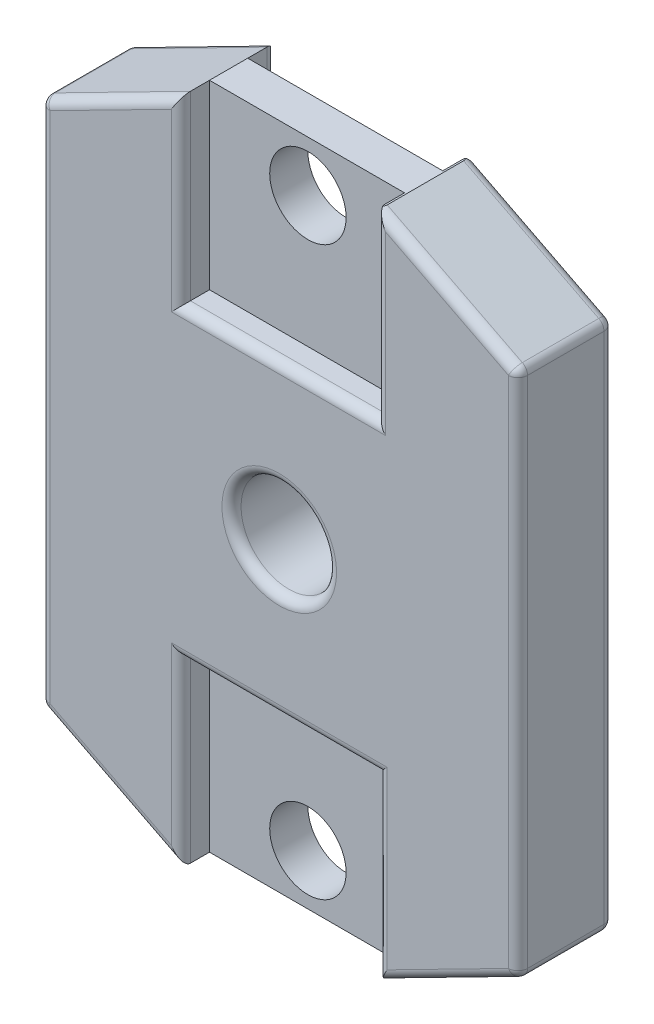
from build123d import *

# Parameters (mm, degrees)
SKETCH_1_W              = 5
SKETCH_1_H              = 7.000000000000001
EXTRUDE_1_DEPTH         = 1
EXTRUDE_2_DEPTH         = 0.25
SKETCH_4_R              = 0.7000000000000005
EXTRUDE_3_DEPTH         = 0.35
SKETCH_5_R              = 0.4999999999999999
CUT_EXTRUDE_1_DEPTH     = 9.707611612836208
CUT_EXTRUDE_2_DEPTH     = 9.660254037844387
SKETCH_8_W              = 2.0606123086601853
SKETCH_8_H              = 1.9
CUT_EXTRUDE_3_DEPTH     = 0.3
CUT_EXTRUDE_4_DEPTH     = 0.3
HOLE_WIZARD_0_8_0_8_1_D = 0.8
FILLET_1_R              = 0.1
FILLET_3_R              = 0.05


with BuildPart() as part:
    # 草图1 → 凸台-拉伸1 (new body)
    with BuildSketch(Plane.XY):
        with Locations((2.5, 3.5000000000000004)):
            Rectangle(SKETCH_1_W, SKETCH_1_H)
    extrude(amount=EXTRUDE_1_DEPTH)

    # 草图2 → 凸台-拉伸2 (add)
    with BuildSketch(Plane.XY):
        with BuildLine():
            ThreePointArc((3.078576199554736, 4.31000667937663), (2.500000000000009, 4.49542013206784), (1.9214238004452784, 4.310006679376641))
            Line((1.9214238004452648, 4.310006679376629), (2.093133264396633, 4.069613429844714))
            ThreePointArc((2.0931332643966383, 4.069613429844718), (2.500000000000017, 4.2), (2.9068667356033893, 4.069613429844699))
            Line((2.906866735603367, 4.069613429844714), (3.0785761995547354, 4.310006679376629))
        make_face()
        with BuildLine():
            Line((2.093133264396633, 4.069613429844714), (1.9214238004452648, 4.310006679376629))
            ThreePointArc((1.9214238004452784, 4.310006679376641), (1.5045798679321596, 3.5), (1.9214238004452784, 2.6899933206233593))
            Line((1.9214238004452637, 2.68999332062337), (2.0931332643966316, 2.9303865701552843))
            ThreePointArc((2.0931332643966374, 2.930386570155282), (1.7999999999999998, 3.5000000000000004), (2.0931332643966383, 4.069613429844718))
        make_face()
        with BuildLine():
            ThreePointArc((3.4954201320678404, 3.5), (3.3850953723464046, 3.955485917649422), (3.078576199554736, 4.31000667937663))
            Line((3.0785761995547354, 4.310006679376629), (2.906866735603367, 4.069613429844714))
            ThreePointArc((2.9068667356033893, 4.069613429844699), (3.122417349903733, 3.8203071066005463), (3.2, 3.5))
            ThreePointArc((3.2, 3.5), (3.122417349903733, 3.1796928933994537), (2.9068667356033897, 2.930386570155301))
            Line((2.9068667356033684, 2.9303865701552843), (3.0785761995547367, 2.689993320623369))
            ThreePointArc((3.0785761995547354, 2.6899933206233695), (3.3850953723464046, 3.0445140823505774), (3.4954201320678404, 3.4999999999999996))
        make_face()
        with BuildLine():
            Line((2.0931332643966316, 2.9303865701552843), (1.9214238004452637, 2.68999332062337))
            ThreePointArc((1.9214238004452784, 2.6899933206233593), (2.5000000000000084, 2.5045798679321596), (3.0785761995547354, 2.6899933206233695))
            Line((3.0785761995547367, 2.689993320623369), (2.9068667356033684, 2.9303865701552843))
            ThreePointArc((2.9068667356033897, 2.930386570155301), (2.500000000000017, 2.8), (2.0931332643966374, 2.930386570155282))
        make_face()
    extrude(amount=-EXTRUDE_2_DEPTH)

    # 草图4 → 凸台-拉伸3 (add)
    with BuildSketch(Plane(origin=(0, 0, 0), x_dir=(-1, 0, 0), z_dir=(0, 0, -1))):
        with Locations(Location((-2.5, 3.5, 0), (0, 0, 180))):
            Circle(SKETCH_4_R)
    extrude(amount=EXTRUDE_3_DEPTH)

    # 草图5 → 切除-拉伸1 (cut, through all)
    with BuildSketch(Plane(origin=(0, 0, -0.35), x_dir=(-1, 0, 0), z_dir=(0, 0, -1))):
        with Locations((-2.5, 3.5)):
            Circle(SKETCH_5_R)
    extrude(amount=-CUT_EXTRUDE_1_DEPTH, mode=Mode.SUBTRACT)

    # 草图7 → 切除-拉伸2 (cut, through all)
    with BuildSketch(Plane.XY):
        Polygon((3.5303061543300926, 7), (4.999999999999998, 6.25), (5, 7), align=None)
        Polygon((0, 6.25), (1.4696938456699076, 7), (0, 7), align=None)
        Polygon((0, 0.75), (0, 0), (1.4696938456699078, 0), align=None)
        Polygon((5, 0.7500000000000002), (3.5303061543300935, 0), (5, 0), align=None)
    extrude(amount=CUT_EXTRUDE_2_DEPTH, mode=Mode.SUBTRACT)

    # 草图8 → 切除-拉伸3 (cut)
    with BuildSketch(Plane.XY):
        Polygon((1.4696938456699076, 6.999999999999999), (1.469693845669908, 5.1), (3.5121371275448117, 5.1), (3.5121371275448108, 6.999999999999998), align=None)
        with Locations((2.5000000000000004, 0.95)):
            Rectangle(SKETCH_8_W, SKETCH_8_H)
    extrude(amount=CUT_EXTRUDE_3_DEPTH, mode=Mode.SUBTRACT)

    # 草图9 → 切除-拉伸4 (cut)
    with BuildSketch(Plane.XY.offset(1)):
        Polygon((1.4696938456699076, 6.999999999999999), (1.4696938456699078, 5.1), (3.5121371275448108, 5.1), (3.5121371275448108, 6.999999999999998), align=None)
        Polygon((1.4696938456699078, -1.1e-16), (3.5303061543300935, 0), (3.5303061543300935, 1.9), (1.4696938456699078, 1.9), align=None)
    extrude(amount=-CUT_EXTRUDE_4_DEPTH, mode=Mode.SUBTRACT)

    # Ø0.8 (0.8) 直径孔1 (through all)
    with Locations(Plane(origin=(0, 0, 0.3), x_dir=(-1, 0, 0), z_dir=(0, 0, -1))):
        with Locations((-2.5, 6.47), (-2.5, 0.53)):
            Hole(HOLE_WIZARD_0_8_0_8_1_D / 2)

    # 圆角1
    # the kernel refuses this fillet: 0.1 mm, written as the material it adds along each edge
    with BuildSketch(Plane(origin=(2.5, 3.5000000000000004, 0), x_dir=(-0.581238193719089, -0.8137334712067403, 0), z_dir=(-0.8137334712067403, 0.581238193719089, 0))) as fillet_1_piece_1:
        with BuildLine():
            CenterArc((0.9954201320678407 + FILLET_1_R, -FILLET_1_R), FILLET_1_R, 90, 90)
            Line((0.9954201320678406, -FILLET_1_R), (0.9954201320678407, 0))
            Line((0.9954201320678407, 0), (0.9954201320678407 + FILLET_1_R, 0))
        make_face()
    revolve(axis=Axis((2.5, 3.5000000000000004, 0), (0, 0, 1)))
    # the kernel refuses this fillet: 0.1 mm, written as the material it takes off along each edge
    with BuildSketch(Plane(origin=(0.1, 6.18876275643042, 0.9), x_dir=(-1, 0, 0), z_dir=(0, 0, 1))) as fillet_1_2_piece_1_section:
        Polygon((0, 0), (FILLET_1_R, 0), (FILLET_1_R, -FILLET_1_R * 0.612372435696), (FILLET_1_R * 0.454545454545, -FILLET_1_R * 0.89072354283), align=None)
    fillet_1_2_piece_1 = extrude(amount=FILLET_1_R, mode=Mode.PRIVATE)
    fillet_1_2_piece_1 = fillet_1_2_piece_1 - Plane(origin=(0.1, 6.18876275643042, 0.9), x_dir=(0.8528028654224417, -0.5222329678670936, 0), z_dir=(0, 0, 1)) * Sphere(FILLET_1_R, mode=Mode.PRIVATE)
    add(fillet_1_2_piece_1, mode=Mode.SUBTRACT)
    with BuildSketch(Plane(origin=(4.899999999999999, 6.18876275643042, 0.9), x_dir=(1, 0, 0), z_dir=(0, 0, 1))) as fillet_1_2_piece_2_section:
        Polygon((0, 0), (FILLET_1_R, 0), (FILLET_1_R, FILLET_1_R * 0.612372435696), (FILLET_1_R * 0.454545454545, FILLET_1_R * 0.89072354283), align=None)
    fillet_1_2_piece_2 = extrude(amount=FILLET_1_R, mode=Mode.PRIVATE)
    fillet_1_2_piece_2 = fillet_1_2_piece_2 - Plane(origin=(4.899999999999999, 6.18876275643042, 0.9), x_dir=(-0.8528028654224419, -0.5222329678670934, 0), z_dir=(0, 0, 1)) * Sphere(FILLET_1_R, mode=Mode.PRIVATE)
    add(fillet_1_2_piece_2, mode=Mode.SUBTRACT)
    with BuildSketch(Plane(origin=(4.900000000000001, 0.8112372435695803, 0.9), x_dir=(1, 0, 0), z_dir=(0, 0, 1))) as fillet_1_2_piece_3_section:
        Polygon((0, 0), (FILLET_1_R, 0), (FILLET_1_R, -FILLET_1_R * 0.612372435696), (FILLET_1_R * 0.454545454545, -FILLET_1_R * 0.89072354283), align=None)
    fillet_1_2_piece_3 = extrude(amount=FILLET_1_R, mode=Mode.PRIVATE)
    fillet_1_2_piece_3 = fillet_1_2_piece_3 - Plane(origin=(4.900000000000001, 0.8112372435695803, 0.9), x_dir=(-0.8528028654224419, 0.5222329678670934, 0), z_dir=(0, 0, 1)) * Sphere(FILLET_1_R, mode=Mode.PRIVATE)
    add(fillet_1_2_piece_3, mode=Mode.SUBTRACT)
    with BuildSketch(Plane(origin=(0.1, 0.8112372435695789, 0.9), x_dir=(-0.45454545454545436, -0.8907235428302468, 0), z_dir=(0, 0, 1))) as fillet_1_2_piece_4_section:
        Polygon((0, 0), (FILLET_1_R, 0), (FILLET_1_R, -FILLET_1_R * 0.612372435696), (FILLET_1_R * 0.454545454545, -FILLET_1_R * 0.89072354283), align=None)
    fillet_1_2_piece_4 = extrude(amount=FILLET_1_R, mode=Mode.PRIVATE)
    fillet_1_2_piece_4 = fillet_1_2_piece_4 - Plane(origin=(0.1, 0.8112372435695789, 0.9), x_dir=(0.8528028654224415, 0.5222329678670936, 0), z_dir=(0, 0, 1)) * Sphere(FILLET_1_R, mode=Mode.PRIVATE)
    add(fillet_1_2_piece_4, mode=Mode.SUBTRACT)
    with BuildSketch(Plane(origin=(4.899999999999999, 6.18876275643042, 0.1), x_dir=(1, 0, 0), z_dir=(0, 0, -1))) as fillet_1_2_piece_5_section:
        Polygon((0, 0), (FILLET_1_R, 0), (FILLET_1_R, -FILLET_1_R * 0.612372435696), (FILLET_1_R * 0.454545454545, -FILLET_1_R * 0.89072354283), align=None)
    fillet_1_2_piece_5 = extrude(amount=FILLET_1_R, mode=Mode.PRIVATE)
    fillet_1_2_piece_5 = fillet_1_2_piece_5 - Plane(origin=(4.899999999999999, 6.18876275643042, 0.1), x_dir=(-0.8528028654224419, -0.5222329678670934, 0), z_dir=(0, 0, -1)) * Sphere(FILLET_1_R, mode=Mode.PRIVATE)
    add(fillet_1_2_piece_5, mode=Mode.SUBTRACT)
    with BuildSketch(Plane(origin=(0.10000000000000009, 6.18876275643042, 0.1), x_dir=(-0.45454545454545436, 0.8907235428302467, 0), z_dir=(0, 0, -1))) as fillet_1_2_piece_6_section:
        Polygon((0, 0), (FILLET_1_R, 0), (FILLET_1_R, -FILLET_1_R * 0.612372435696), (FILLET_1_R * 0.454545454545, -FILLET_1_R * 0.89072354283), align=None)
    fillet_1_2_piece_6 = extrude(amount=FILLET_1_R, mode=Mode.PRIVATE)
    fillet_1_2_piece_6 = fillet_1_2_piece_6 - Plane(origin=(0.10000000000000009, 6.18876275643042, 0.1), x_dir=(0.8528028654224417, -0.5222329678670936, 0), z_dir=(0, 0, -1)) * Sphere(FILLET_1_R, mode=Mode.PRIVATE)
    add(fillet_1_2_piece_6, mode=Mode.SUBTRACT)
    with BuildSketch(Plane(origin=(0.10000000000000009, 0.8112372435695794, 0.1), x_dir=(-1, 0, 0), z_dir=(0, 0, -1))) as fillet_1_2_piece_7_section:
        Polygon((0, 0), (FILLET_1_R, 0), (FILLET_1_R, -FILLET_1_R * 0.612372435696), (FILLET_1_R * 0.454545454545, -FILLET_1_R * 0.89072354283), align=None)
    fillet_1_2_piece_7 = extrude(amount=FILLET_1_R, mode=Mode.PRIVATE)
    fillet_1_2_piece_7 = fillet_1_2_piece_7 - Plane(origin=(0.10000000000000009, 0.8112372435695794, 0.1), x_dir=(0.8528028654224415, 0.5222329678670936, 0), z_dir=(0, 0, -1)) * Sphere(FILLET_1_R, mode=Mode.PRIVATE)
    add(fillet_1_2_piece_7, mode=Mode.SUBTRACT)
    with BuildSketch(Plane(origin=(4.900000000000001, 0.8112372435695803, 0.1), x_dir=(1, 0, 0), z_dir=(0, 0, -1))) as fillet_1_2_piece_8_section:
        Polygon((0, 0), (FILLET_1_R, 0), (FILLET_1_R, FILLET_1_R * 0.612372435696), (FILLET_1_R * 0.454545454545, FILLET_1_R * 0.89072354283), align=None)
    fillet_1_2_piece_8 = extrude(amount=FILLET_1_R, mode=Mode.PRIVATE)
    fillet_1_2_piece_8 = fillet_1_2_piece_8 - Plane(origin=(4.900000000000001, 0.8112372435695803, 0.1), x_dir=(-0.8528028654224419, 0.5222329678670934, 0), z_dir=(0, 0, -1)) * Sphere(FILLET_1_R, mode=Mode.PRIVATE)
    add(fillet_1_2_piece_8, mode=Mode.SUBTRACT)
    with BuildSketch(Plane(origin=(1.6923747313774689, 7.113636363636363, 1), x_dir=(0.4545454545454544, -0.8907235428302467, 0), z_dir=(-0.8907235428302467, -0.45454545454545436, 0))) as fillet_1_2_piece_9:
        with BuildLine():
            CenterArc((FILLET_1_R, -FILLET_1_R), FILLET_1_R, 90, 90)
            Line((1e-16, -FILLET_1_R), (0, 0))
            Line((0, 0), (FILLET_1_R, 0))
        make_face()
    extrude(amount=1.8387627564304205, mode=Mode.SUBTRACT)
    with BuildSketch(Plane(origin=(1.4696938456699076, 7.249999999999999, 1), x_dir=(-1, -1.2e-16, 0), z_dir=(1.2e-16, -1, 0))) as fillet_1_2_piece_10:
        with BuildLine():
            CenterArc((FILLET_1_R, FILLET_1_R), FILLET_1_R, 180, 90)
            Line((0, FILLET_1_R), (0, 0))
            Line((0, 0), (FILLET_1_R, 0))
        make_face()
    extrude(amount=2.1499999999999995, mode=Mode.SUBTRACT)
    with BuildSketch(Plane(origin=(1.4696938456699078, 5.1, 1), x_dir=(0, -1, 0), z_dir=(1, 0, 0))) as fillet_1_2_piece_11:
        with BuildLine():
            CenterArc((FILLET_1_R, FILLET_1_R), FILLET_1_R, 180, 90)
            Line((0, FILLET_1_R), (0, 0))
            Line((0, 0), (FILLET_1_R, 0))
        make_face()
    extrude(amount=2.042443281874903, mode=Mode.SUBTRACT)
    with BuildSketch(Plane(origin=(3.5121371275448108, 5.1, 1), x_dir=(1, 0, 0), z_dir=(0, 1, 0))) as fillet_1_2_piece_12:
        with BuildLine():
            CenterArc((FILLET_1_R, FILLET_1_R), FILLET_1_R, 180, 90)
            Line((0, FILLET_1_R), (0, 0))
            Line((0, 0), (FILLET_1_R, 0))
        make_face()
    extrude(amount=2.1499999999999986, mode=Mode.SUBTRACT)
    with BuildSketch(Plane(origin=(4.945454545454544, 6.277835110713444, 1), x_dir=(-0.4545454545454548, -0.8907235428302464, 0), z_dir=(-0.8907235428302465, 0.45454545454545486, 0))) as fillet_1_2_piece_13:
        with BuildLine():
            CenterArc((FILLET_1_R, -FILLET_1_R), FILLET_1_R, 90, 90)
            Line((4e-16, -FILLET_1_R), (0, 0))
            Line((0, 0), (FILLET_1_R, 0))
        make_face()
    extrude(amount=1.8387627564304219, mode=Mode.SUBTRACT)
    with BuildSketch(Plane(origin=(3.307625268622531, -0.11363636363636398, 1), x_dir=(1.05e-15, -2.05e-15, -1), z_dir=(0.8907235428302465, 0.45454545454545475, 0))) as fillet_1_2_piece_14:
        with BuildLine():
            CenterArc((FILLET_1_R, FILLET_1_R), FILLET_1_R, 179.99999999999997, 90.00000000000017)
            Line((-2.3e-16, FILLET_1_R), (0, 0))
            Line((0, 0), (FILLET_1_R, 0))
        make_face()
    extrude(amount=1.838762756430423, mode=Mode.SUBTRACT)
    with BuildSketch(Plane(origin=(3.5303061543300935, -0.2500000000000002, 1), x_dir=(0, 0, -1), z_dir=(0, 1, 0))) as fillet_1_2_piece_15:
        with BuildLine():
            CenterArc((FILLET_1_R, -FILLET_1_R), FILLET_1_R, 90, 90)
            Line((0, -FILLET_1_R), (0, 0))
            Line((0, 0), (FILLET_1_R, 0))
        make_face()
    extrude(amount=2.1500000000000004, mode=Mode.SUBTRACT)
    with BuildSketch(Plane(origin=(3.5303061543300935, 1.9, 1), x_dir=(0, 1, 0), z_dir=(-1, 0, 0))) as fillet_1_2_piece_16:
        with BuildLine():
            CenterArc((FILLET_1_R, FILLET_1_R), FILLET_1_R, 180, 90)
            Line((0, FILLET_1_R), (0, 0))
            Line((0, 0), (FILLET_1_R, 0))
        make_face()
    extrude(amount=2.0606123086601857, mode=Mode.SUBTRACT)
    with BuildSketch(Plane(origin=(1.4696938456699078, 1.9, 1), x_dir=(-1, 0, 0), z_dir=(0, -1, 0))) as fillet_1_2_piece_17:
        with BuildLine():
            CenterArc((FILLET_1_R, FILLET_1_R), FILLET_1_R, 180, 90)
            Line((0, FILLET_1_R), (0, 0))
            Line((0, 0), (FILLET_1_R, 0))
        make_face()
    extrude(amount=2.1500000000000004, mode=Mode.SUBTRACT)
    with BuildSketch(Plane(origin=(0.05454545454545445, 0.7221648892865544, 1), x_dir=(0.45454545454545436, 0.8907235428302467, 0), z_dir=(0.8907235428302468, -0.45454545454545436, 0))) as fillet_1_2_piece_18:
        with BuildLine():
            CenterArc((FILLET_1_R, -FILLET_1_R), FILLET_1_R, 90, 90)
            Line((-9e-17, -FILLET_1_R), (0, 0))
            Line((0, 0), (FILLET_1_R, 0))
        make_face()
    extrude(amount=1.8387627564304219, mode=Mode.SUBTRACT)
    with BuildSketch(Plane(origin=(2.5, 3.5, 1), x_dir=(-1, 0, 0), z_dir=(0, -1, 0))) as fillet_1_2_piece_19:
        with BuildLine():
            CenterArc((0.5 + FILLET_1_R, FILLET_1_R), FILLET_1_R, 180, 90)
            Line((0.5, FILLET_1_R), (0.5, 0))
            Line((0.5, 0), (0.5 + FILLET_1_R, 0))
        make_face()
    revolve(axis=Axis((2.5, 3.5, 1), (0, 0, -1)), mode=Mode.SUBTRACT)
    with BuildSketch(Plane(origin=(3.3076252686225303, 7.113636363636363, 0), x_dir=(-0.45454545454545486, -0.8907235428302465, 0), z_dir=(0.8907235428302465, -0.45454545454545486, 0))) as fillet_1_2_piece_20:
        with BuildLine():
            CenterArc((FILLET_1_R, -FILLET_1_R), FILLET_1_R, 90, 90)
            Line((2e-16, -FILLET_1_R), (0, 0))
            Line((0, 0), (FILLET_1_R, 0))
        make_face()
    extrude(amount=1.838762756430421, mode=Mode.SUBTRACT)
    with BuildSketch(Plane(origin=(3.5121371275448117, 5.1, 0), x_dir=(1, 4.7e-16, 0), z_dir=(-4.7e-16, 1, 0))) as fillet_1_2_piece_21:
        with BuildLine():
            CenterArc((FILLET_1_R, -FILLET_1_R), FILLET_1_R, 90, 90)
            Line((0, -FILLET_1_R), (0, 0))
            Line((0, 0), (FILLET_1_R, 0))
        make_face()
    extrude(amount=2.1499999999999986, mode=Mode.SUBTRACT)
    with BuildSketch(Plane(origin=(1.469693845669908, 5.1, 0), x_dir=(0, -1, 0), z_dir=(1, 0, 0))) as fillet_1_2_piece_22:
        with BuildLine():
            CenterArc((FILLET_1_R, -FILLET_1_R), FILLET_1_R, 90, 90)
            Line((0, -FILLET_1_R), (0, 0))
            Line((0, 0), (FILLET_1_R, 0))
        make_face()
    extrude(amount=2.0424432818749034, mode=Mode.SUBTRACT)
    with BuildSketch(Plane(origin=(1.4696938456699076, 7.249999999999999, 0), x_dir=(-1, -2.3e-16, 0), z_dir=(2.3e-16, -1, 0))) as fillet_1_2_piece_23:
        with BuildLine():
            CenterArc((FILLET_1_R, -FILLET_1_R), FILLET_1_R, 90, 90)
            Line((0, -FILLET_1_R), (0, 0))
            Line((0, 0), (FILLET_1_R, 0))
        make_face()
    extrude(amount=2.1499999999999995, mode=Mode.SUBTRACT)
    with BuildSketch(Plane(origin=(0.05454545454545463, 6.277835110713445, 0), x_dir=(0.4545454545454544, -0.8907235428302468, 0), z_dir=(0.8907235428302467, 0.45454545454545436, 0))) as fillet_1_2_piece_24:
        with BuildLine():
            CenterArc((FILLET_1_R, -FILLET_1_R), FILLET_1_R, 90, 90)
            Line((6.6e-16, -FILLET_1_R), (0, 0))
            Line((0, 0), (FILLET_1_R, 0))
        make_face()
    extrude(amount=1.8387627564304219, mode=Mode.SUBTRACT)
    with BuildSketch(Plane(origin=(1.6923747313774695, -0.11363636363636376, 0), x_dir=(0.4545454545454543, 0.8907235428302467, 0), z_dir=(-0.8907235428302468, 0.45454545454545436, 0))) as fillet_1_2_piece_25:
        with BuildLine():
            CenterArc((FILLET_1_R, -FILLET_1_R), FILLET_1_R, 90, 90)
            Line((-2e-16, -FILLET_1_R), (0, 0))
            Line((0, 0), (FILLET_1_R, 0))
        make_face()
    extrude(amount=1.8387627564304216, mode=Mode.SUBTRACT)
    with BuildSketch(Plane(origin=(1.4696938456699078, -0.25000000000000044, 0), x_dir=(-1, 0, 0), z_dir=(0, 1, 0))) as fillet_1_2_piece_26:
        with BuildLine():
            CenterArc((FILLET_1_R, FILLET_1_R), FILLET_1_R, 180, 90)
            Line((0, FILLET_1_R), (0, 0))
            Line((0, 0), (FILLET_1_R, 0))
        make_face()
    extrude(amount=2.15, mode=Mode.SUBTRACT)
    with BuildSketch(Plane(origin=(1.4696938456699078, 1.8999999999999997, 0), x_dir=(0, 1, 0), z_dir=(1, 0, 0))) as fillet_1_2_piece_27:
        with BuildLine():
            CenterArc((FILLET_1_R, FILLET_1_R), FILLET_1_R, 180, 90)
            Line((0, FILLET_1_R), (0, 0))
            Line((0, 0), (FILLET_1_R, 0))
        make_face()
    extrude(amount=2.0606123086601853, mode=Mode.SUBTRACT)
    with BuildSketch(Plane(origin=(3.530306154330093, 1.8999999999999997, 0), x_dir=(1, 0, 0), z_dir=(0, -1, 0))) as fillet_1_2_piece_28:
        with BuildLine():
            CenterArc((FILLET_1_R, FILLET_1_R), FILLET_1_R, 180, 90)
            Line((0, FILLET_1_R), (0, 0))
            Line((0, 0), (FILLET_1_R, 0))
        make_face()
    extrude(amount=2.15, mode=Mode.SUBTRACT)
    with BuildSketch(Plane(origin=(4.945454545454547, 0.7221648892865558, 0), x_dir=(-1.31e-15, 2.57e-15, 1), z_dir=(-0.8907235428302465, -0.45454545454545475, 0))) as fillet_1_2_piece_29:
        with BuildLine():
            CenterArc((FILLET_1_R, FILLET_1_R), FILLET_1_R, 180, 89.99999999999983)
            Line((2.7e-16, FILLET_1_R), (0, 0))
            Line((0, 0), (FILLET_1_R, 0))
        make_face()
    extrude(amount=1.838762756430423, mode=Mode.SUBTRACT)
    with BuildSketch(Plane(origin=(0, 0.75, 0.1), x_dir=(0.8907235428302469, -0.45454545454545403, 0), z_dir=(0, 0, 1))) as fillet_1_2_piece_30:
        with BuildLine():
            CenterArc((FILLET_1_R * 0.612372435696, FILLET_1_R), FILLET_1_R, 207.03569178941214, 62.96430821058789)
            Line((-FILLET_1_R * 0.278351107134, FILLET_1_R * 0.545454545455), (0, 0))
            Line((0, 0), (FILLET_1_R * 0.612372435696, 0))
        make_face()
    extrude(amount=0.8, mode=Mode.SUBTRACT)
    with BuildSketch(Plane(origin=(0, 6.18876275643042, 0), x_dir=(1, 0, 0), z_dir=(0, -1, 0))) as fillet_1_2_piece_31:
        with BuildLine():
            CenterArc((FILLET_1_R, FILLET_1_R), FILLET_1_R, 180, 90)
            Line((8e-17, FILLET_1_R), (0, 0))
            Line((0, 0), (FILLET_1_R, 0))
        make_face()
    extrude(amount=5.37752551286084, mode=Mode.SUBTRACT)
    with BuildSketch(Plane(origin=(0, 6.25, 0.1), x_dir=(0, -1, 0), z_dir=(0, 0, 1))) as fillet_1_2_piece_32:
        with BuildLine():
            CenterArc((FILLET_1_R * 0.612372435696, FILLET_1_R), FILLET_1_R, 207.03569178941234, 62.96430821058766)
            Line((-FILLET_1_R * 0.278351107134, FILLET_1_R * 0.545454545455), (0, 0))
            Line((0, 0), (FILLET_1_R * 0.612372435696, 0))
        make_face()
    extrude(amount=0.8, mode=Mode.SUBTRACT)
    with BuildSketch(Plane(origin=(0, 6.18876275643042, 1), x_dir=(1, 0, 0), z_dir=(0, -1, 0))) as fillet_1_2_piece_33:
        with BuildLine():
            CenterArc((FILLET_1_R, -FILLET_1_R), FILLET_1_R, 90, 90)
            Line((8e-17, -FILLET_1_R), (0, 0))
            Line((0, 0), (FILLET_1_R, 0))
        make_face()
    extrude(amount=5.377525512860841, mode=Mode.SUBTRACT)
    with BuildSketch(Plane(origin=(5, 0.8112372435695805, 1), x_dir=(-1, 0, 0), z_dir=(0, 1, 0))) as fillet_1_2_piece_34:
        with BuildLine():
            CenterArc((FILLET_1_R, -FILLET_1_R), FILLET_1_R, 90, 90)
            Line((0, -FILLET_1_R), (0, 0))
            Line((0, 0), (FILLET_1_R, 0))
        make_face()
    extrude(amount=5.3775255128608395, mode=Mode.SUBTRACT)
    with BuildSketch(Plane(origin=(4.999999999999998, 6.25, 0.1), x_dir=(2.901e-14, -1, 0), z_dir=(0, 0, 1))) as fillet_1_2_piece_35:
        with BuildLine():
            CenterArc((FILLET_1_R * 0.612372435696, -FILLET_1_R), FILLET_1_R, 89.99999999999835, 62.96430821058917)
            Line((-FILLET_1_R * 0.278351107134, -FILLET_1_R * 0.545454545455), (0, 0))
            Line((0, 0), (FILLET_1_R * 0.612372435696, 0))
        make_face()
    extrude(amount=0.8, mode=Mode.SUBTRACT)
    with BuildSketch(Plane(origin=(5, 0.8112372435695805, 0), x_dir=(-1, 0, 0), z_dir=(0, 1, 0))) as fillet_1_2_piece_36:
        with BuildLine():
            CenterArc((FILLET_1_R, FILLET_1_R), FILLET_1_R, 180, 90)
            Line((0, FILLET_1_R), (0, 0))
            Line((0, 0), (FILLET_1_R, 0))
        make_face()
    extrude(amount=5.3775255128608395, mode=Mode.SUBTRACT)
    with BuildSketch(Plane(origin=(5, 0.7500000000000002, 0.1), x_dir=(-0.890723542830246, -0.45454545454545575, 0), z_dir=(0, 0, 1))) as fillet_1_2_piece_37:
        with BuildLine():
            CenterArc((FILLET_1_R * 0.612372435696, -FILLET_1_R), FILLET_1_R, 90.00000000000018, 62.96430821058733)
            Line((-FILLET_1_R * 0.278351107134, -FILLET_1_R * 0.545454545455), (0, 0))
            Line((0, 0), (FILLET_1_R * 0.612372435696, 0))
        make_face()
    extrude(amount=0.8, mode=Mode.SUBTRACT)
    with BuildSketch(Plane(origin=(1.4696938456699076, 7.249999999999999, 1), x_dir=(-1, -1.2e-16, 0), z_dir=(1.2e-16, -1, 0))) as fillet_1_2_piece_38a_section:
        with BuildLine():
            CenterArc((FILLET_1_R, FILLET_1_R), FILLET_1_R, 180, 90)
            Line((0, FILLET_1_R), (0, 0))
            Line((0, 0), (FILLET_1_R, 0))
        make_face()
    fillet_1_2_piece_38a = extrude(amount=2.3999999999999995, mode=Mode.PRIVATE)
    fillet_1_2_piece_38a = split(fillet_1_2_piece_38a, bisect_by=Plane(origin=(1.4470543342432254, 5.1, 0.9773604885733174), z_dir=(0, -1, 0)), keep=Keep.TOP, mode=Mode.PRIVATE)
    with BuildSketch(Plane(origin=(1.2196938456699078, 5.1, 1), x_dir=(0, -1, 0), z_dir=(1, 0, 0))) as fillet_1_2_piece_38b_section:
        with BuildLine():
            CenterArc((FILLET_1_R, FILLET_1_R), FILLET_1_R, 180, 90)
            Line((0, FILLET_1_R), (0, 0))
            Line((0, 0), (FILLET_1_R, 0))
        make_face()
    fillet_1_2_piece_38b = extrude(amount=2.292443281874903, mode=Mode.PRIVATE)
    fillet_1_2_piece_38b = split(fillet_1_2_piece_38b, bisect_by=Plane(origin=(1.4696938456699078, 5.077360488573317, 0.9773604885733179), z_dir=(-1, -1.2e-16, 0)), keep=Keep.TOP, mode=Mode.PRIVATE)
    fillet_1_2_piece_38 = fillet_1_2_piece_38a & fillet_1_2_piece_38b
    add(fillet_1_2_piece_38, mode=Mode.SUBTRACT)
    with BuildSketch(Plane(origin=(1.4696938456699078, 5.1, 1), x_dir=(0, -1, 0), z_dir=(1, 0, 0))) as fillet_1_2_piece_39a_section:
        with BuildLine():
            CenterArc((FILLET_1_R, FILLET_1_R), FILLET_1_R, 180, 90)
            Line((0, FILLET_1_R), (0, 0))
            Line((0, 0), (FILLET_1_R, 0))
        make_face()
    fillet_1_2_piece_39a = extrude(amount=2.292443281874903, mode=Mode.PRIVATE)
    fillet_1_2_piece_39a = split(fillet_1_2_piece_39a, bisect_by=Plane(origin=(3.5121371275448108, 5.077360488573317, 0.977360488573318), z_dir=(1, 0, 0)), keep=Keep.TOP, mode=Mode.PRIVATE)
    with BuildSketch(Plane(origin=(3.5121371275448108, 4.85, 1), x_dir=(1, 0, 0), z_dir=(0, 1, 0))) as fillet_1_2_piece_39b_section:
        with BuildLine():
            CenterArc((FILLET_1_R, FILLET_1_R), FILLET_1_R, 180, 90)
            Line((0, FILLET_1_R), (0, 0))
            Line((0, 0), (FILLET_1_R, 0))
        make_face()
    fillet_1_2_piece_39b = extrude(amount=2.3999999999999986, mode=Mode.PRIVATE)
    fillet_1_2_piece_39b = split(fillet_1_2_piece_39b, bisect_by=Plane(origin=(3.5347766389714934, 5.1, 0.9773604885733177), z_dir=(0, -1, 0)), keep=Keep.TOP, mode=Mode.PRIVATE)
    fillet_1_2_piece_39 = fillet_1_2_piece_39a & fillet_1_2_piece_39b
    add(fillet_1_2_piece_39, mode=Mode.SUBTRACT)
    with BuildSketch(Plane(origin=(3.5303061543300935, -0.2500000000000002, 1), x_dir=(0, 0, -1), z_dir=(0, 1, 0))) as fillet_1_2_piece_40a_section:
        with BuildLine():
            CenterArc((FILLET_1_R, -FILLET_1_R), FILLET_1_R, 90, 90)
            Line((0, -FILLET_1_R), (0, 0))
            Line((0, 0), (FILLET_1_R, 0))
        make_face()
    fillet_1_2_piece_40a = extrude(amount=2.4000000000000004, mode=Mode.PRIVATE)
    fillet_1_2_piece_40a = split(fillet_1_2_piece_40a, bisect_by=Plane(origin=(3.5529456657567766, 1.9, 0.9773604885733177), z_dir=(0, 1, 0)), keep=Keep.TOP, mode=Mode.PRIVATE)
    with BuildSketch(Plane(origin=(3.780306154330094, 1.9, 1), x_dir=(0, 1, 0), z_dir=(-1, 0, 0))) as fillet_1_2_piece_40b_section:
        with BuildLine():
            CenterArc((FILLET_1_R, FILLET_1_R), FILLET_1_R, 180, 90)
            Line((0, FILLET_1_R), (0, 0))
            Line((0, 0), (FILLET_1_R, 0))
        make_face()
    fillet_1_2_piece_40b = extrude(amount=2.310612308660186, mode=Mode.PRIVATE)
    fillet_1_2_piece_40b = split(fillet_1_2_piece_40b, bisect_by=Plane(origin=(3.5303061543300935, 1.9226395114266825, 0.9773604885733176), z_dir=(1, 0, 0)), keep=Keep.TOP, mode=Mode.PRIVATE)
    fillet_1_2_piece_40 = fillet_1_2_piece_40a & fillet_1_2_piece_40b
    add(fillet_1_2_piece_40, mode=Mode.SUBTRACT)
    with BuildSketch(Plane(origin=(3.5303061543300935, 1.9, 1), x_dir=(0, 1, 0), z_dir=(-1, 0, 0))) as fillet_1_2_piece_41a_section:
        with BuildLine():
            CenterArc((FILLET_1_R, FILLET_1_R), FILLET_1_R, 180, 90)
            Line((0, FILLET_1_R), (0, 0))
            Line((0, 0), (FILLET_1_R, 0))
        make_face()
    fillet_1_2_piece_41a = extrude(amount=2.310612308660186, mode=Mode.PRIVATE)
    fillet_1_2_piece_41a = split(fillet_1_2_piece_41a, bisect_by=Plane(origin=(1.4696938456699078, 1.9226395114266825, 0.9773604885733176), z_dir=(-1, 0, 0)), keep=Keep.TOP, mode=Mode.PRIVATE)
    with BuildSketch(Plane(origin=(1.4696938456699078, 2.1500000000000004, 1), x_dir=(-1, 0, 0), z_dir=(0, -1, 0))) as fillet_1_2_piece_41b_section:
        with BuildLine():
            CenterArc((FILLET_1_R, FILLET_1_R), FILLET_1_R, 180, 90)
            Line((0, FILLET_1_R), (0, 0))
            Line((0, 0), (FILLET_1_R, 0))
        make_face()
    fillet_1_2_piece_41b = extrude(amount=2.400000000000001, mode=Mode.PRIVATE)
    fillet_1_2_piece_41b = split(fillet_1_2_piece_41b, bisect_by=Plane(origin=(1.4470543342432252, 1.9, 0.9773604885733175), z_dir=(0, 1, 0)), keep=Keep.TOP, mode=Mode.PRIVATE)
    fillet_1_2_piece_41 = fillet_1_2_piece_41a & fillet_1_2_piece_41b
    add(fillet_1_2_piece_41, mode=Mode.SUBTRACT)
    with BuildSketch(Plane(origin=(1.469693845669908, 5.1, 0), x_dir=(0, -1, 0), z_dir=(1, 0, 0))) as fillet_1_2_piece_42a_section:
        with BuildLine():
            CenterArc((FILLET_1_R, -FILLET_1_R), FILLET_1_R, 90, 90)
            Line((0, -FILLET_1_R), (0, 0))
            Line((0, 0), (FILLET_1_R, 0))
        make_face()
    fillet_1_2_piece_42a = extrude(amount=2.2924432818749034, mode=Mode.PRIVATE)
    fillet_1_2_piece_42a = split(fillet_1_2_piece_42a, bisect_by=Plane(origin=(3.5121371275448117, 5.077360488573317, 0.02263951142668213), z_dir=(1, 4.7e-16, 0)), keep=Keep.TOP, mode=Mode.PRIVATE)
    with BuildSketch(Plane(origin=(3.5121371275448117, 4.85, 0), x_dir=(1, 4.7e-16, 0), z_dir=(-4.7e-16, 1, 0))) as fillet_1_2_piece_42b_section:
        with BuildLine():
            CenterArc((FILLET_1_R, -FILLET_1_R), FILLET_1_R, 90, 90)
            Line((0, -FILLET_1_R), (0, 0))
            Line((0, 0), (FILLET_1_R, 0))
        make_face()
    fillet_1_2_piece_42b = extrude(amount=2.3999999999999986, mode=Mode.PRIVATE)
    fillet_1_2_piece_42b = split(fillet_1_2_piece_42b, bisect_by=Plane(origin=(3.5347766389714934, 5.1, 0.02263951142668237), z_dir=(0, -1, 0)), keep=Keep.TOP, mode=Mode.PRIVATE)
    fillet_1_2_piece_42 = fillet_1_2_piece_42a & fillet_1_2_piece_42b
    add(fillet_1_2_piece_42, mode=Mode.SUBTRACT)
    with BuildSketch(Plane(origin=(1.4696938456699076, 7.249999999999999, 0), x_dir=(-1, -2.3e-16, 0), z_dir=(2.3e-16, -1, 0))) as fillet_1_2_piece_43a_section:
        with BuildLine():
            CenterArc((FILLET_1_R, -FILLET_1_R), FILLET_1_R, 90, 90)
            Line((0, -FILLET_1_R), (0, 0))
            Line((0, 0), (FILLET_1_R, 0))
        make_face()
    fillet_1_2_piece_43a = extrude(amount=2.3999999999999995, mode=Mode.PRIVATE)
    fillet_1_2_piece_43a = split(fillet_1_2_piece_43a, bisect_by=Plane(origin=(1.4470543342432258, 5.1, 0.02263951142668256), z_dir=(0, -1, 0)), keep=Keep.TOP, mode=Mode.PRIVATE)
    with BuildSketch(Plane(origin=(1.219693845669908, 5.1, 0), x_dir=(0, -1, 0), z_dir=(1, 0, 0))) as fillet_1_2_piece_43b_section:
        with BuildLine():
            CenterArc((FILLET_1_R, -FILLET_1_R), FILLET_1_R, 90, 90)
            Line((0, -FILLET_1_R), (0, 0))
            Line((0, 0), (FILLET_1_R, 0))
        make_face()
    fillet_1_2_piece_43b = extrude(amount=2.2924432818749034, mode=Mode.PRIVATE)
    fillet_1_2_piece_43b = split(fillet_1_2_piece_43b, bisect_by=Plane(origin=(1.469693845669908, 5.077360488573317, 0.02263951142668214), z_dir=(-1, -2.3e-16, 0)), keep=Keep.TOP, mode=Mode.PRIVATE)
    fillet_1_2_piece_43 = fillet_1_2_piece_43a & fillet_1_2_piece_43b
    add(fillet_1_2_piece_43, mode=Mode.SUBTRACT)
    with BuildSketch(Plane(origin=(1.4696938456699078, -0.25000000000000044, 0), x_dir=(-1, 0, 0), z_dir=(0, 1, 0))) as fillet_1_2_piece_44a_section:
        with BuildLine():
            CenterArc((FILLET_1_R, FILLET_1_R), FILLET_1_R, 180, 90)
            Line((0, FILLET_1_R), (0, 0))
            Line((0, 0), (FILLET_1_R, 0))
        make_face()
    fillet_1_2_piece_44a = extrude(amount=2.4000000000000004, mode=Mode.PRIVATE)
    fillet_1_2_piece_44a = split(fillet_1_2_piece_44a, bisect_by=Plane(origin=(1.4470543342432254, 1.8999999999999997, 0.02263951142668257), z_dir=(0, 1, 0)), keep=Keep.TOP, mode=Mode.PRIVATE)
    with BuildSketch(Plane(origin=(1.2196938456699076, 1.8999999999999997, 0), x_dir=(0, 1, 0), z_dir=(1, 0, 0))) as fillet_1_2_piece_44b_section:
        with BuildLine():
            CenterArc((FILLET_1_R, FILLET_1_R), FILLET_1_R, 180, 90)
            Line((0, FILLET_1_R), (0, 0))
            Line((0, 0), (FILLET_1_R, 0))
        make_face()
    fillet_1_2_piece_44b = extrude(amount=2.3106123086601853, mode=Mode.PRIVATE)
    fillet_1_2_piece_44b = split(fillet_1_2_piece_44b, bisect_by=Plane(origin=(1.4696938456699078, 1.922639511426682, 0.02263951142668257), z_dir=(-1, 0, 0)), keep=Keep.TOP, mode=Mode.PRIVATE)
    fillet_1_2_piece_44 = fillet_1_2_piece_44a & fillet_1_2_piece_44b
    add(fillet_1_2_piece_44, mode=Mode.SUBTRACT)
    with BuildSketch(Plane(origin=(1.4696938456699078, 1.8999999999999997, 0), x_dir=(0, 1, 0), z_dir=(1, 0, 0))) as fillet_1_2_piece_45a_section:
        with BuildLine():
            CenterArc((FILLET_1_R, FILLET_1_R), FILLET_1_R, 180, 90)
            Line((0, FILLET_1_R), (0, 0))
            Line((0, 0), (FILLET_1_R, 0))
        make_face()
    fillet_1_2_piece_45a = extrude(amount=2.3106123086601857, mode=Mode.PRIVATE)
    fillet_1_2_piece_45a = split(fillet_1_2_piece_45a, bisect_by=Plane(origin=(3.530306154330093, 1.9226395114266823, 0.02263951142668257), z_dir=(1, 0, 0)), keep=Keep.TOP, mode=Mode.PRIVATE)
    with BuildSketch(Plane(origin=(3.530306154330093, 2.1499999999999995, 0), x_dir=(1, 0, 0), z_dir=(0, -1, 0))) as fillet_1_2_piece_45b_section:
        with BuildLine():
            CenterArc((FILLET_1_R, FILLET_1_R), FILLET_1_R, 180, 90)
            Line((0, FILLET_1_R), (0, 0))
            Line((0, 0), (FILLET_1_R, 0))
        make_face()
    fillet_1_2_piece_45b = extrude(amount=2.4000000000000004, mode=Mode.PRIVATE)
    fillet_1_2_piece_45b = split(fillet_1_2_piece_45b, bisect_by=Plane(origin=(3.5529456657567757, 1.8999999999999997, 0.02263951142668235), z_dir=(0, 1, 0)), keep=Keep.TOP, mode=Mode.PRIVATE)
    fillet_1_2_piece_45 = fillet_1_2_piece_45a & fillet_1_2_piece_45b
    add(fillet_1_2_piece_45, mode=Mode.SUBTRACT)

    # 圆角3
    fillet_3_edges = [part.edges().sort_by_distance(p)[0] for p in [
        (1.7999999999999954, 3.4999999999999796, -0.25),
        (3, 3.5, -0.35),
    ]]
    fillet(fillet_3_edges, radius=FILLET_3_R)


solid = part.part
